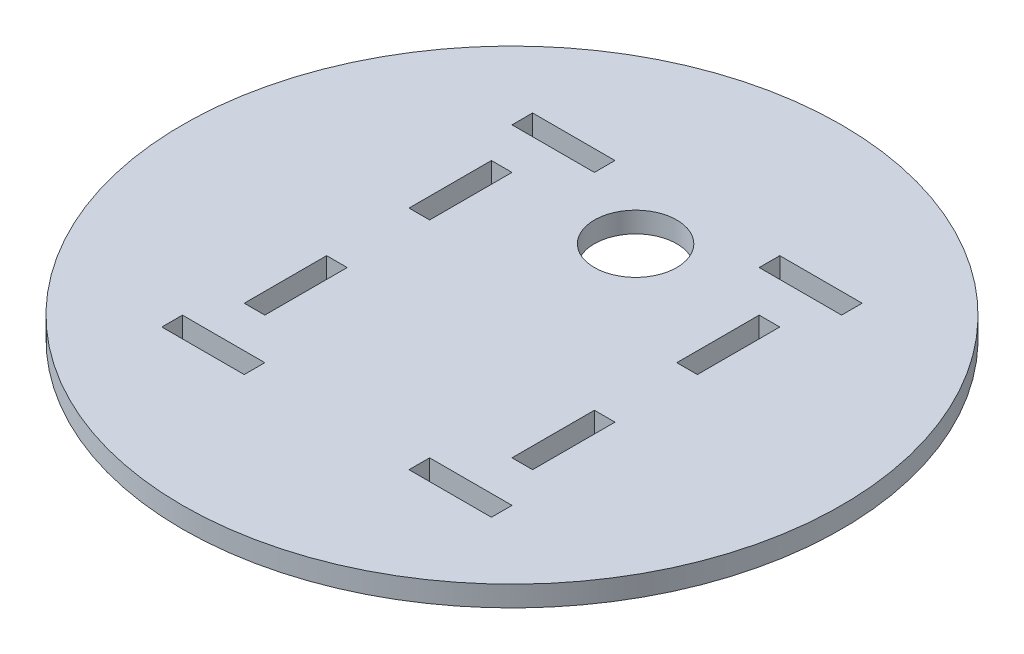
from build123d import *

# Parameters (mm, degrees)
SKETCH1_R           = 101.6
SKETCH1_R_2         = 12.7
SKETCH1_W           = 25.4
SKETCH1_H           = 6.35
SKETCH1_W_2         = 6.35
SKETCH1_H_2         = 25.4
BOSS_EXTRUDE1_DEPTH = 6.35


with BuildPart() as part:
    # Sketch1 → Boss-Extrude1 (new body)
    with BuildSketch(Plane(origin=(0, 0, 0), x_dir=(1, 0, 0), z_dir=(0, 1, 0))):
        Circle(SKETCH1_R)
        with Locations((0, 38.1)):
            Circle(SKETCH1_R_2, mode=Mode.SUBTRACT)
        with Locations((-38.1, 53.975)):
            Rectangle(SKETCH1_W, SKETCH1_H, mode=Mode.SUBTRACT)
        with Locations((38.1, 53.975)):
            Rectangle(SKETCH1_W, SKETCH1_H, mode=Mode.SUBTRACT)
        with Locations((-38.1, -53.975)):
            Rectangle(SKETCH1_W, SKETCH1_H, mode=Mode.SUBTRACT)
        with Locations((38.1, -53.975)):
            Rectangle(SKETCH1_W, SKETCH1_H, mode=Mode.SUBTRACT)
        with Locations((41.275, -25.4)):
            Rectangle(SKETCH1_W_2, SKETCH1_H_2, mode=Mode.SUBTRACT)
        with Locations((41.275, 25.4)):
            Rectangle(SKETCH1_W_2, SKETCH1_H_2, mode=Mode.SUBTRACT)
        with Locations((-41.275, -25.4)):
            Rectangle(SKETCH1_W_2, SKETCH1_H_2, mode=Mode.SUBTRACT)
        with Locations((-41.275, 25.4)):
            Rectangle(SKETCH1_W_2, SKETCH1_H_2, mode=Mode.SUBTRACT)
    extrude(amount=BOSS_EXTRUDE1_DEPTH)


solid = part.part
